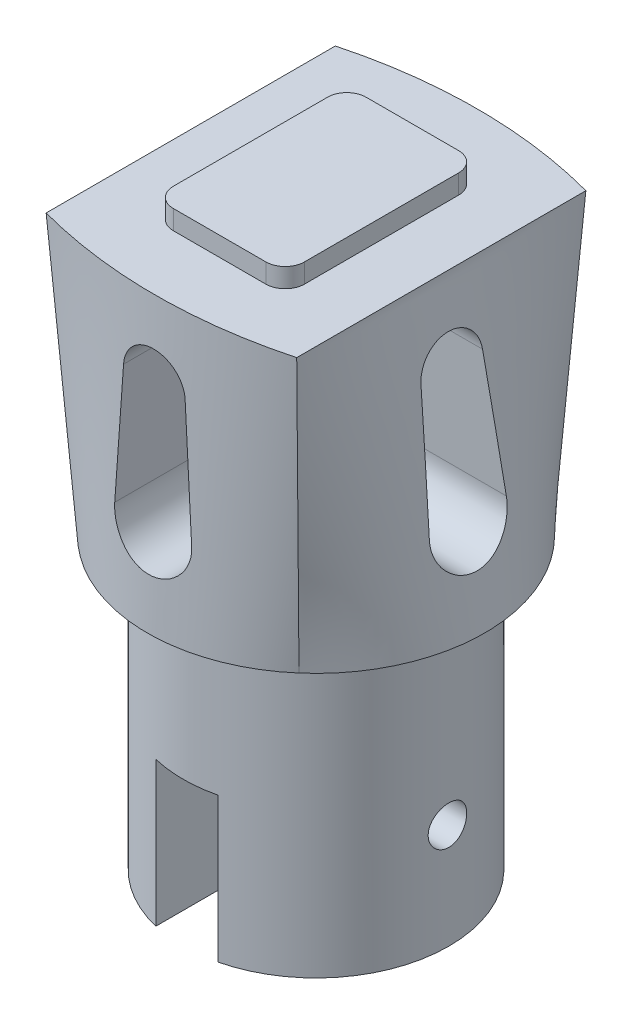
from build123d import *

# Parameters (mm, degrees)
EXTRUDE_1_DEPTH          = 20
SKETCH_6_R               = 137.82883427
EXTRUDE_2_DEPTH          = 300
SKETCH_7_W               = 64.33647864
SKETCH_7_H               = 328.296669272
CUT_EXTRUDE_5_DEPTH      = 150
CUT_EXTRUDE_8_DEPTH      = 420.456409487
CUT_EXTRUDE_8_DEPTH_BACK = 420.456409487
SKETCH_8_R               = 20
CUT_EXTRUDE_1_DEPTH      = 405.53677221
CUT_EXTRUDE_1_DEPTH_BACK = 405.53677221
CUT_EXTRUDE_2_DEPTH      = 405.53677221
CUT_EXTRUDE_2_DEPTH_BACK = 405.53677221


with BuildPart() as part:
    # 放样1: read off the stored shape, not the designer's step
    # 放样1: loft between two sections, ruled curve by curve
    loft_1_from = [
        Edge.make_bspline([(-130, 300, -150), (-124.769619995, 300, -151.408333333), (-119.505058397, 300, -152.734620381), (-108.91545275, 300, -155.21918968), (-103.5904087, 300, -156.377471931), (-92.887718882, 300, -158.52211941), (-87.510083706, 300, -159.508477501), (-76.710665652, 300, -161.306375375), (-71.288882774, 300, -162.117915158), (-60.409602146, 300, -163.563289402), (-54.952116374, 300, -164.197118856), (-44.01026912, 300, -165.285292056), (-38.525907637, 300, -165.739635801), (-27.539124169, 300, -166.467067205), (-22.036715036, 300, -166.740152284), (-11.022872794, 300, -167.10446459), (-5.511439685, 300, -167.195691817), (5.511439685, 300, -167.195691817), (11.022872794, 300, -167.10446459), (22.036715036, 300, -166.740152284), (27.539124169, 300, -166.467067205), (38.525907637, 300, -165.739635801), (44.01026912, 300, -165.285292056), (54.952116374, 300, -164.197118856), (60.409602146, 300, -163.563289402), (71.288882774, 300, -162.117915158), (76.710665652, 300, -161.306375375), (87.510083706, 300, -159.508477501), (92.887718882, 300, -158.52211941), (103.5904087, 300, -156.377471931), (108.91545275, 300, -155.21918968), (119.505058397, 300, -152.734620381), (124.769619995, 300, -151.408333333), (130, 300, -150)], [0, 0, 0, 0, 0.0625, 0.0625, 0.125, 0.125, 0.1875, 0.1875, 0.25, 0.25, 0.3125, 0.3125, 0.375, 0.375, 0.4375, 0.4375, 0.5, 0.5, 0.5625, 0.5625, 0.625, 0.625, 0.6875, 0.6875, 0.75, 0.75, 0.8125, 0.8125, 0.875, 0.875, 0.9375, 0.9375, 1, 1, 1, 1], 3),
        Edge.make_bspline([(130, 300, -150), (130, 300, -143.75), (130, 300, -137.5), (130, 300, -125), (130, 300, -118.75), (130, 300, -106.25), (130, 300, -100), (130, 300, -87.5), (130, 300, -81.25), (130, 300, -68.75), (130, 300, -62.5), (130, 300, -50), (130, 300, -43.75), (130, 300, -31.25), (130, 300, -25), (130, 300, -12.5), (130, 300, -6.25), (130, 300, 6.25), (130, 300, 12.5), (130, 300, 25), (130, 300, 31.25), (130, 300, 43.75), (130, 300, 50), (130, 300, 62.5), (130, 300, 68.75), (130, 300, 81.25), (130, 300, 87.5), (130, 300, 100), (130, 300, 106.25), (130, 300, 118.75), (130, 300, 125), (130, 300, 137.5), (130, 300, 143.75), (130, 300, 150)], [0, 0, 0, 0, 0.0625, 0.0625, 0.125, 0.125, 0.1875, 0.1875, 0.25, 0.25, 0.3125, 0.3125, 0.375, 0.375, 0.4375, 0.4375, 0.5, 0.5, 0.5625, 0.5625, 0.625, 0.625, 0.6875, 0.6875, 0.75, 0.75, 0.8125, 0.8125, 0.875, 0.875, 0.9375, 0.9375, 1, 1, 1, 1], 3),
        Edge.make_bspline([(-130, 300, 150), (-130, 300, 143.75), (-130, 300, 137.5), (-130, 300, 125), (-130, 300, 118.75), (-130, 300, 106.25), (-130, 300, 100), (-130, 300, 87.5), (-130, 300, 81.25), (-130, 300, 68.75), (-130, 300, 62.5), (-130, 300, 50), (-130, 300, 43.75), (-130, 300, 31.25), (-130, 300, 25), (-130, 300, 12.5), (-130, 300, 6.25), (-130, 300, -6.25), (-130, 300, -12.5), (-130, 300, -25), (-130, 300, -31.25), (-130, 300, -43.75), (-130, 300, -50), (-130, 300, -62.5), (-130, 300, -68.75), (-130, 300, -81.25), (-130, 300, -87.5), (-130, 300, -100), (-130, 300, -106.25), (-130, 300, -118.75), (-130, 300, -125), (-130, 300, -137.5), (-130, 300, -143.75), (-130, 300, -150)], [0, 0, 0, 0, 0.0625, 0.0625, 0.125, 0.125, 0.1875, 0.1875, 0.25, 0.25, 0.3125, 0.3125, 0.375, 0.375, 0.4375, 0.4375, 0.5, 0.5, 0.5625, 0.5625, 0.625, 0.625, 0.6875, 0.6875, 0.75, 0.75, 0.8125, 0.8125, 0.875, 0.875, 0.9375, 0.9375, 1, 1, 1, 1], 3),
        Edge.make_bspline([(130, 300, 150), (124.769619995, 300, 151.408333333), (119.505058397, 300, 152.734620381), (108.91545275, 300, 155.21918968), (103.5904087, 300, 156.377471931), (92.887718882, 300, 158.52211941), (87.510083706, 300, 159.508477501), (76.710665652, 300, 161.306375375), (71.288882774, 300, 162.117915158), (60.409602146, 300, 163.563289402), (54.952116374, 300, 164.197118856), (44.01026912, 300, 165.285292056), (38.525907637, 300, 165.739635801), (27.539124169, 300, 166.467067205), (22.036715036, 300, 166.740152284), (11.022872794, 300, 167.10446459), (5.511439685, 300, 167.195691817), (-5.511439685, 300, 167.195691817), (-11.022872794, 300, 167.10446459), (-22.036715036, 300, 166.740152284), (-27.539124169, 300, 166.467067205), (-38.525907637, 300, 165.739635801), (-44.01026912, 300, 165.285292056), (-54.952116374, 300, 164.197118856), (-60.409602146, 300, 163.563289402), (-71.288882774, 300, 162.117915158), (-76.710665652, 300, 161.306375375), (-87.510083706, 300, 159.508477501), (-92.887718882, 300, 158.52211941), (-103.5904087, 300, 156.377471931), (-108.91545275, 300, 155.21918968), (-119.505058397, 300, 152.734620381), (-124.769619995, 300, 151.408333333), (-130, 300, 150)], [0, 0, 0, 0, 0.0625, 0.0625, 0.125, 0.125, 0.1875, 0.1875, 0.25, 0.25, 0.3125, 0.3125, 0.375, 0.375, 0.4375, 0.4375, 0.5, 0.5, 0.5625, 0.5625, 0.625, 0.625, 0.6875, 0.6875, 0.75, 0.75, 0.8125, 0.8125, 0.875, 0.875, 0.9375, 0.9375, 1, 1, 1, 1], 3),
    ]
    loft_1_to = [
        Edge.make_bspline([(-114.612844223, 0, -132.245589488), (-111.004024426, 0, -135.373233312), (-107.211669234, 0, -138.400967779), (-99.272487901, 0, -144.201744261), (-95.125637959, 0, -146.974714431), (-86.500263832, 0, -152.21089986), (-82.021734424, 0, -154.674033513), (-72.766523929, 0, -159.237729689), (-67.989860066, 0, -161.338206482), (-58.182462612, 0, -165.128552913), (-53.151770565, 0, -166.81833993), (-42.890081451, 0, -169.746605751), (-37.659149425, 0, -170.985013046), (-27.05882293, 0, -172.97949683), (-21.689513175, 0, -173.735520543), (-10.88008747, 0, -174.745786149), (-5.440069341, 0, -175), (5.440069341, 0, -175), (10.88008747, 0, -174.745786149), (21.689513175, 0, -173.735520543), (27.05882293, 0, -172.97949683), (37.659149425, 0, -170.985013046), (42.890081451, 0, -169.746605751), (53.151770565, 0, -166.81833993), (58.182462612, 0, -165.128552913), (67.989860066, 0, -161.338206482), (72.766523929, 0, -159.237729689), (82.021734424, 0, -154.674033513), (86.500263832, 0, -152.21089986), (95.125637959, 0, -146.974714431), (99.272487901, 0, -144.201744261), (107.211669234, 0, -138.400967779), (111.004024426, 0, -135.373233312), (114.612844223, 0, -132.245589488)], [0, 0, 0, 0, 0.0625, 0.0625, 0.125, 0.125, 0.1875, 0.1875, 0.25, 0.25, 0.3125, 0.3125, 0.375, 0.375, 0.4375, 0.4375, 0.5, 0.5, 0.5625, 0.5625, 0.625, 0.625, 0.6875, 0.6875, 0.75, 0.75, 0.8125, 0.8125, 0.875, 0.875, 0.9375, 0.9375, 1, 1, 1, 1], 3),
        Edge.make_bspline([(114.612844223, 0, -132.245589488), (118.776867066, 0, -128.636769691), (122.860615366, 0, -124.752734901), (130.774776966, 0, -116.429950541), (134.605052867, 0, -111.991083814), (141.912664309, 0, -102.5734801), (145.389814421, 0, -97.594663542), (151.889784013, 0, -87.134436372), (154.912382075, 0, -81.653004875), (160.4062324, 0, -70.248842926), (162.877249432, 0, -64.326166728), (167.182243451, 0, -52.124385688), (169.016001457, 0, -45.845416721), (171.979040274, 0, -33.036656752), (173.10815103, 0, -26.507075805), (174.618677458, 0, -13.318201965), (175, 0, -6.659171207), (175, 0, 6.659171207), (174.618677458, 0, 13.318201965), (173.10815103, 0, 26.507075805), (171.979040274, 0, 33.036656752), (169.016001457, 0, 45.845416721), (167.182243451, 0, 52.124385688), (162.877249432, 0, 64.326166728), (160.4062324, 0, 70.248842926), (154.912382075, 0, 81.653004875), (151.889784013, 0, 87.134436372), (145.389814421, 0, 97.594663542), (141.912664309, 0, 102.5734801), (134.605052867, 0, 111.991083814), (130.774776966, 0, 116.429950541), (122.860615366, 0, 124.752734901), (118.776867066, 0, 128.636769691), (114.612844223, 0, 132.245589488)], [0, 0, 0, 0, 0.0625, 0.0625, 0.125, 0.125, 0.1875, 0.1875, 0.25, 0.25, 0.3125, 0.3125, 0.375, 0.375, 0.4375, 0.4375, 0.5, 0.5, 0.5625, 0.5625, 0.625, 0.625, 0.6875, 0.6875, 0.75, 0.75, 0.8125, 0.8125, 0.875, 0.875, 0.9375, 0.9375, 1, 1, 1, 1], 3),
        Edge.make_bspline([(-114.612844223, 0, 132.245589488), (-118.776867066, 0, 128.636769691), (-122.860615366, 0, 124.752734901), (-130.774776966, 0, 116.429950541), (-134.605052867, 0, 111.991083814), (-141.912664309, 0, 102.5734801), (-145.389814421, 0, 97.594663542), (-151.889784013, 0, 87.134436372), (-154.912382075, 0, 81.653004875), (-160.4062324, 0, 70.248842926), (-162.877249432, 0, 64.326166728), (-167.182243451, 0, 52.124385688), (-169.016001457, 0, 45.845416721), (-171.979040274, 0, 33.036656752), (-173.10815103, 0, 26.507075805), (-174.618677458, 0, 13.318201965), (-175, 0, 6.659171207), (-175, 0, -6.659171207), (-174.618677458, 0, -13.318201965), (-173.10815103, 0, -26.507075805), (-171.979040274, 0, -33.036656752), (-169.016001457, 0, -45.845416721), (-167.182243451, 0, -52.124385688), (-162.877249432, 0, -64.326166728), (-160.4062324, 0, -70.248842926), (-154.912382075, 0, -81.653004875), (-151.889784013, 0, -87.134436372), (-145.389814421, 0, -97.594663542), (-141.912664309, 0, -102.5734801), (-134.605052867, 0, -111.991083814), (-130.774776966, 0, -116.429950541), (-122.860615366, 0, -124.752734901), (-118.776867066, 0, -128.636769691), (-114.612844223, 0, -132.245589488)], [0, 0, 0, 0, 0.0625, 0.0625, 0.125, 0.125, 0.1875, 0.1875, 0.25, 0.25, 0.3125, 0.3125, 0.375, 0.375, 0.4375, 0.4375, 0.5, 0.5, 0.5625, 0.5625, 0.625, 0.625, 0.6875, 0.6875, 0.75, 0.75, 0.8125, 0.8125, 0.875, 0.875, 0.9375, 0.9375, 1, 1, 1, 1], 3),
        Edge.make_bspline([(114.612844223, 0, 132.245589488), (111.004024426, 0, 135.373233312), (107.211669234, 0, 138.400967779), (99.272487901, 0, 144.201744261), (95.125637959, 0, 146.974714431), (86.500263832, 0, 152.21089986), (82.021734424, 0, 154.674033513), (72.766523929, 0, 159.237729689), (67.989860066, 0, 161.338206482), (58.182462612, 0, 165.128552913), (53.151770565, 0, 166.81833993), (42.890081451, 0, 169.746605751), (37.659149425, 0, 170.985013046), (27.05882293, 0, 172.97949683), (21.689513175, 0, 173.735520543), (10.88008747, 0, 174.745786149), (5.440069341, 0, 175), (-5.440069341, 0, 175), (-10.88008747, 0, 174.745786149), (-21.689513175, 0, 173.735520543), (-27.05882293, 0, 172.97949683), (-37.659149425, 0, 170.985013046), (-42.890081451, 0, 169.746605751), (-53.151770565, 0, 166.81833993), (-58.182462612, 0, 165.128552913), (-67.989860066, 0, 161.338206482), (-72.766523929, 0, 159.237729689), (-82.021734424, 0, 154.674033513), (-86.500263832, 0, 152.21089986), (-95.125637959, 0, 146.974714431), (-99.272487901, 0, 144.201744261), (-107.211669234, 0, 138.400967779), (-111.004024426, 0, 135.373233312), (-114.612844223, 0, 132.245589488)], [0, 0, 0, 0, 0.0625, 0.0625, 0.125, 0.125, 0.1875, 0.1875, 0.25, 0.25, 0.3125, 0.3125, 0.375, 0.375, 0.4375, 0.4375, 0.5, 0.5, 0.5625, 0.5625, 0.625, 0.625, 0.6875, 0.6875, 0.75, 0.75, 0.8125, 0.8125, 0.875, 0.875, 0.9375, 0.9375, 1, 1, 1, 1], 3),
    ]
    loft_1 = Solid(Shell([*[Face.make_surface_from_curves(loft_1_from[k], loft_1_to[k]) for k in range(4)], Face(Wire(loft_1_from)), Face(Wire(loft_1_to))]))
    add(loft_1)

    # 草图3 → 凸台-拉伸1 (add)
    with BuildSketch(Plane(origin=(0, 300, 0), x_dir=(1, 0, 0), z_dir=(0, 1, 0))):
        with BuildLine():
            Line((-48, -100), (48, -100))
            ThreePointArc((48, -100), (62.142135624, -94.142135624), (68, -80))
            Line((68, -80), (68, 80))
            ThreePointArc((68, 80), (62.142135624, 94.142135624), (48, 100))
            Line((48, 100), (-48, 100))
            ThreePointArc((-48, 100), (-62.142135624, 94.142135624), (-68, 80))
            Line((-68, 80), (-68, -80))
            ThreePointArc((-68, -80), (-62.142135624, -94.142135624), (-48, -100))
        make_face()
    extrude(amount=EXTRUDE_1_DEPTH)

    # 草图6 → 凸台-拉伸2 (add)
    with BuildSketch(Plane.XZ):
        with Locations(Location((0, 0, 0), (0, 0, 270))):
            Circle(SKETCH_6_R)
    extrude(amount=EXTRUDE_2_DEPTH)

    # 草图7 → 切除-拉伸5 (cut)
    with BuildSketch(Plane.XZ.offset(300)):
        Rectangle(SKETCH_7_W, SKETCH_7_H)
    extrude(amount=-CUT_EXTRUDE_5_DEPTH, mode=Mode.SUBTRACT)

    # 草图8 → 切除-拉伸8 (cut, two sides: drawn at the far end of the back side and taken through both)
    with BuildSketch(Plane(origin=(-32.16823932, 0, 0), x_dir=(0, 0, -1), z_dir=(1, 0, 0)).offset(-CUT_EXTRUDE_8_DEPTH_BACK)):
        with Locations((0, -191.170473685)):
            Circle(SKETCH_8_R)
    extrude(amount=CUT_EXTRUDE_8_DEPTH + CUT_EXTRUDE_8_DEPTH_BACK, mode=Mode.SUBTRACT)

    # 草图4 → 切除-拉伸1 (cut, two sides: drawn at the far end of the back side and taken through both)
    with BuildSketch(Plane.XY.offset(-CUT_EXTRUDE_1_DEPTH_BACK)):
        with BuildLine():
            Line((-31.937438845, 222), (-39.921798557, 94.5))
            ThreePointArc((-39.921798557, 94.5), (0, 52), (39.921798557, 94.5))
            Line((39.921798557, 94.5), (31.937438845, 222))
            ThreePointArc((31.937438845, 222), (0, 252), (-31.937438845, 222))
        make_face()
    extrude(amount=CUT_EXTRUDE_1_DEPTH + CUT_EXTRUDE_1_DEPTH_BACK, mode=Mode.SUBTRACT)

    # 草图5 → 切除-拉伸2 (cut, two sides: drawn at the far end of the back side and taken through both)
    with BuildSketch(Plane(origin=(0, 0, 0), x_dir=(0, 0, -1), z_dir=(1, 0, 0)).offset(-CUT_EXTRUDE_2_DEPTH_BACK)):
        with BuildLine():
            Line((39.921798557, 94.5), (31.937438845, 222))
            ThreePointArc((31.937438845, 222), (0, 252), (-31.937438845, 222))
            Line((-31.937438845, 222), (-39.921798557, 94.5))
            ThreePointArc((-39.921798557, 94.5), (0, 52), (39.921798557, 94.5))
        make_face()
    extrude(amount=CUT_EXTRUDE_2_DEPTH + CUT_EXTRUDE_2_DEPTH_BACK, mode=Mode.SUBTRACT)


solid = part.part
